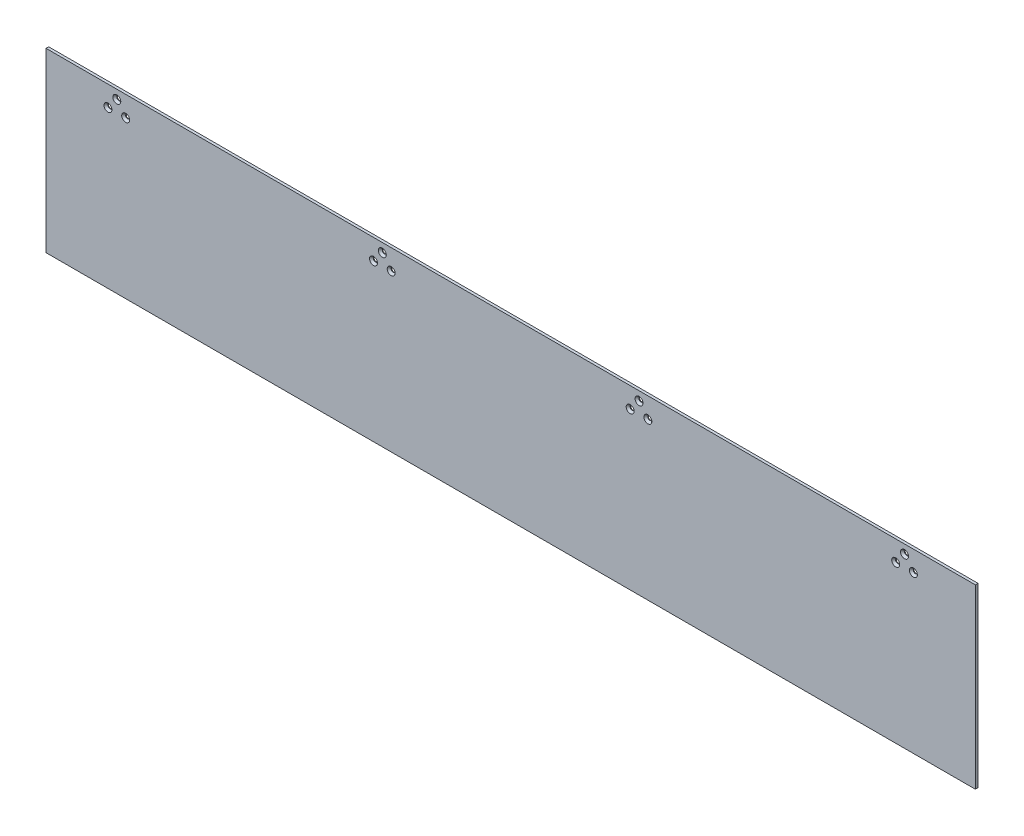
from build123d import *

# Parameters (mm, degrees)
SKETCH1_W                    = 1050
SKETCH1_H                    = 200
BOSS_EXTRUDE1_DEPTH          = 3
CSK_FOR_M4_SFHCS1_AT_2_COUNT = 2
CSK_FOR_M4_SFHCS1_AT_2_PITCH = 20
CSK_FOR_M4_SFHCS1_AT_3_COUNT = 2
CSK_FOR_M4_SFHCS1_AT_3_PITCH = 300
CSK_FOR_M4_SFHCS1_AT_4_COUNT = 2
CSK_FOR_M4_SFHCS1_AT_4_PITCH = 320
CSK_FOR_M4_SFHCS1_AT_5_COUNT = 2
CSK_FOR_M4_SFHCS1_AT_5_PITCH = 16.401219467
CSK_FOR_M4_SFHCS1_AT_6_COUNT = 2
CSK_FOR_M4_SFHCS1_AT_6_PITCH = 310.272460911


with BuildPart() as part:
    # Sketch1 → Boss-Extrude1 (new body)
    with BuildSketch(Plane.XY):
        Rectangle(SKETCH1_W, SKETCH1_H)
    extrude(amount=BOSS_EXTRUDE1_DEPTH)

    # Sketch3 → CSK for M4 SFHCS1 (revolve, cut)
    with BuildSketch(Plane(origin=(-455, 77, 3), x_dir=(0, -1, 0), z_dir=(1, 0, 0))):
        Polygon((0, 0), (0, 3), (2.25, 3), (2.25, 2.23), (4.48, 0), align=None)
    csk_for_m4_sfhcs1 = revolve(axis=Axis((-455, 77, 9.35), (0, 0, -1)), mode=Mode.SUBTRACT)

    # CSK for M4 SFHCS1 at 2: CSK for M4 SFHCS1 ×2
    with Locations(*[(i * CSK_FOR_M4_SFHCS1_AT_2_PITCH, 0, 0) for i in range(1, CSK_FOR_M4_SFHCS1_AT_2_COUNT)]):
        add(csk_for_m4_sfhcs1, mode=Mode.SUBTRACT)

    # CSK for M4 SFHCS1 at 3: CSK for M4 SFHCS1 ×2
    with Locations(*[(i * CSK_FOR_M4_SFHCS1_AT_3_PITCH, 0, 0) for i in range(1, CSK_FOR_M4_SFHCS1_AT_3_COUNT)]):
        add(csk_for_m4_sfhcs1, mode=Mode.SUBTRACT)

    # CSK for M4 SFHCS1 at 4: CSK for M4 SFHCS1 ×2
    with Locations(*[(i * CSK_FOR_M4_SFHCS1_AT_4_PITCH, 0, 0) for i in range(1, CSK_FOR_M4_SFHCS1_AT_4_COUNT)]):
        add(csk_for_m4_sfhcs1, mode=Mode.SUBTRACT)

    # CSK for M4 SFHCS1 at 5: CSK for M4 SFHCS1 ×2
    with Locations(*[Vector(0.609710760849692, 0.7926239891046003, 0) * (i * CSK_FOR_M4_SFHCS1_AT_5_PITCH) for i in range(1, CSK_FOR_M4_SFHCS1_AT_5_COUNT)]):
        add(csk_for_m4_sfhcs1, mode=Mode.SUBTRACT)

    # CSK for M4 SFHCS1 at 6: CSK for M4 SFHCS1 ×2
    with Locations(*[Vector(0.9991218656319883, 0.0418986588813415, 0) * (i * CSK_FOR_M4_SFHCS1_AT_6_PITCH) for i in range(1, CSK_FOR_M4_SFHCS1_AT_6_COUNT)]):
        add(csk_for_m4_sfhcs1, mode=Mode.SUBTRACT)

    # Mirror1: CSK for M4 SFHCS1 across plane
    add(csk_for_m4_sfhcs1.mirror(Plane(origin=(0, 0, 0), x_dir=(0, 0, 1), z_dir=(1, 0, 0))), mode=Mode.SUBTRACT)

    # Mirror1 copy 1 sketch → Mirror1 copy 1 (revolve, cut)
    with BuildSketch(Plane(origin=(435, 77, 3), x_dir=(0, -1, 0), z_dir=(-1, 0, 0))):
        Polygon((0, 0), (0, -3), (2.25, -3), (2.25, -2.23), (4.48, 0), align=None)
    revolve(axis=Axis((435, 77, 9.35), (0, 0, 1)), mode=Mode.SUBTRACT)

    # Mirror1 copy 2 sketch → Mirror1 copy 2 (revolve, cut)
    with BuildSketch(Plane(origin=(155, 77, 3), x_dir=(0, -1, 0), z_dir=(-1, 0, 0))):
        Polygon((0, 0), (0, -3), (2.25, -3), (2.25, -2.23), (4.48, 0), align=None)
    revolve(axis=Axis((155, 77, 9.35), (0, 0, 1)), mode=Mode.SUBTRACT)

    # Mirror1 copy 3 sketch → Mirror1 copy 3 (revolve, cut)
    with BuildSketch(Plane(origin=(135, 77, 3), x_dir=(0, -1, 0), z_dir=(-1, 0, 0))):
        Polygon((0, 0), (0, -3), (2.25, -3), (2.25, -2.23), (4.48, 0), align=None)
    revolve(axis=Axis((135, 77, 9.35), (0, 0, 1)), mode=Mode.SUBTRACT)

    # Mirror1 copy 4 sketch → Mirror1 copy 4 (revolve, cut)
    with BuildSketch(Plane(origin=(445, 90, 3), x_dir=(0, -1, 0), z_dir=(-1, 0, 0))):
        Polygon((0, 0), (0, -3), (2.25, -3), (2.25, -2.23), (4.48, 0), align=None)
    revolve(axis=Axis((445, 90, 9.35), (0, 0, 1)), mode=Mode.SUBTRACT)

    # Mirror1 copy 5 sketch → Mirror1 copy 5 (revolve, cut)
    with BuildSketch(Plane(origin=(145, 90, 3), x_dir=(0, -1, 0), z_dir=(-1, 0, 0))):
        Polygon((0, 0), (0, -3), (2.25, -3), (2.25, -2.23), (4.48, 0), align=None)
    revolve(axis=Axis((145, 90, 9.35), (0, 0, 1)), mode=Mode.SUBTRACT)


solid = part.part
